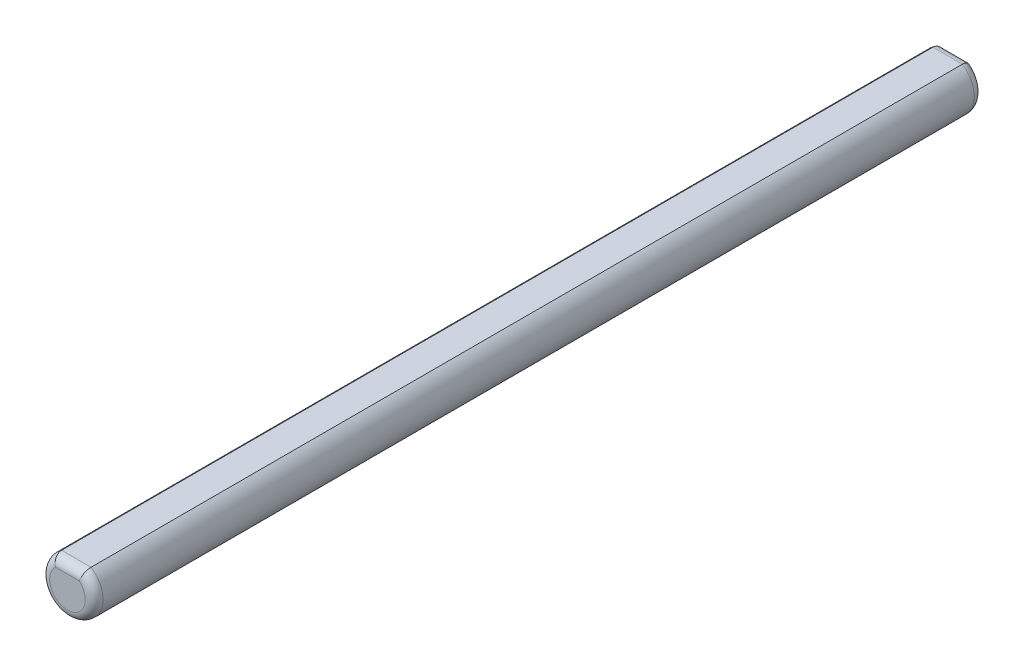
from build123d import *

# Parameters (mm, degrees)
BOSS_EXTRUDE1_DEPTH = 100
FILLET1_R           = 1


with BuildPart() as part:
    # Sketch1 → Boss-Extrude1 (new body)
    with BuildSketch(Plane.XY.offset(115.120373728)):
        with BuildLine():
            Line((43.606003854, 44.364343494), (40.289379064, 44.364343494))
            ThreePointArc((40.289379064, 44.364343494), (41.947691459, 38.864343494), (43.606003854, 44.364343494))
        make_face()
    extrude(amount=-BOSS_EXTRUDE1_DEPTH)

    # Fillet1
    # the kernel refuses this fillet: 1 mm, written as the material it takes off along each edge
    with BuildSketch(Plane(origin=(46.106003854, 44.364343494, 115.120373728), x_dir=(0, 0, -1), z_dir=(-1, 0, 0))) as fillet1_piece_1:
        with BuildLine():
            CenterArc((FILLET1_R, FILLET1_R), FILLET1_R, 180, 90)
            Line((0, FILLET1_R), (0, 0))
            Line((0, 0), (FILLET1_R, 0))
        make_face()
    extrude(amount=8.31662479, mode=Mode.SUBTRACT)
    with BuildSketch(Plane(origin=(41.947691459, 41.864343494, 115.120373728), x_dir=(-0.0031415874858803736, 0.9999950652018582, 0), z_dir=(0.9999950652018582, 0.0031415874858803736, 0))) as fillet1_piece_2:
        with BuildLine():
            CenterArc((3 - FILLET1_R, -FILLET1_R), FILLET1_R, 0, 90)
            Line((3 - FILLET1_R, 0), (3, 0))
            Line((3, 0), (3, -FILLET1_R))
        make_face()
    revolve(axis=Axis((41.947691459, 41.864343494, 115.120373728), (0, 0, 1)), revolution_arc=359.64, mode=Mode.SUBTRACT)
    with BuildSketch(Plane(origin=(41.947691459, 41.864343494, 15.120373728), x_dir=(-0.0031415874858803736, 0.9999950652018582, 0), z_dir=(0.9999950652018582, 0.0031415874858803736, 0))) as fillet1_piece_3:
        with BuildLine():
            CenterArc((3 - FILLET1_R, FILLET1_R), FILLET1_R, 270, 90)
            Line((3 - FILLET1_R, 0), (3, 0))
            Line((3, 0), (3, FILLET1_R))
        make_face()
    revolve(axis=Axis((41.947691459, 41.864343494, 15.120373728), (0, 0, 1)), revolution_arc=359.64, mode=Mode.SUBTRACT)
    with BuildSketch(Plane(origin=(46.106003854, 44.364343494, 15.120373728), x_dir=(0, 0, 1), z_dir=(-1, 0, 0))) as fillet1_piece_4:
        with BuildLine():
            CenterArc((FILLET1_R, -FILLET1_R), FILLET1_R, 90, 90)
            Line((0, -FILLET1_R), (0, 0))
            Line((0, 0), (FILLET1_R, 0))
        make_face()
    extrude(amount=8.31662479, mode=Mode.SUBTRACT)


solid = part.part
